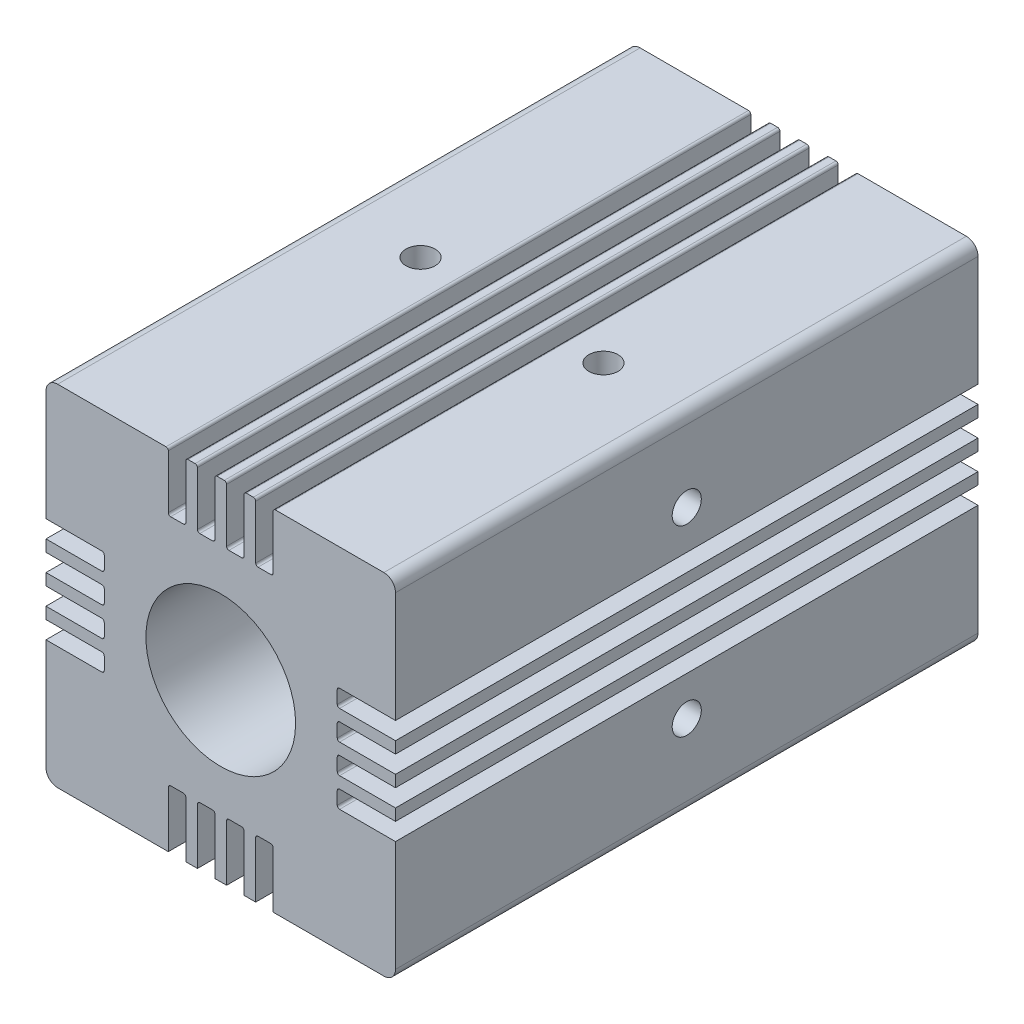
from build123d import *

# Parameters (mm, degrees)
SKETCH1_W                        = 30
SKETCH1_H                        = 30
BOSS_EXTRUDE1_DEPTH              = 50
FILLET1_R                        = 1
CUT_EXTRUDE2_START               = -30
CUT_EXTRUDE2_OUTLINE_R           = 6.425
CUT_EXTRUDE2_DEPTH               = 30
TAP_DRILL_FOR_M3_TAP1_D          = 2.5
TAP_DRILL_FOR_M3_TAP2_AT_2_COUNT = 2
TAP_DRILL_FOR_M3_TAP2_AT_2_PITCH = 15.7
CUT_EXTRUDE5_REACH               = 67.574
SKETCH6_W                        = 1.5
SKETCH6_H                        = 5
FILLET2_R                        = 0.2
CIRPATTERN1_DEPTH                = 50
CIRPATTERN1_2_OUTLINE_R          = 1.25
CIRPATTERN1_2_DEPTH              = 7.1500001
CIRPATTERN1_START                = 22.8499999
CIRPATTERN1_3_OUTLINE_R          = 1.25
CIRPATTERN1_3_DEPTH              = 7.1500001


# Read off the part's stored shape, not the designer's step: Cut-Extrude2, CirPattern1
with BuildPart() as part:
    # Sketch1 → Boss-Extrude1 (new body)
    with BuildSketch(Plane.XY):
        with Locations((15, 15)):
            Rectangle(SKETCH1_W, SKETCH1_H)
    extrude(amount=BOSS_EXTRUDE1_DEPTH)

    # Fillet1
    fillet1_edges = [part.edges().sort_by_distance(p)[0] for p in [
        (0, 30, 25),
        (30, 30, 25),
        (30, 0, 25),
        (0, 0, 25),
    ]]
    fillet(fillet1_edges, radius=FILLET1_R)

    # Cut-Extrude2 outline → Cut-Extrude2 (cut)
    with BuildSketch(Plane.XY.offset(50).offset(CUT_EXTRUDE2_START)):
        with Locations((15, 15)):
            Circle(CUT_EXTRUDE2_OUTLINE_R)
    extrude(amount=CUT_EXTRUDE2_DEPTH, mode=Mode.SUBTRACT)

    # Tap Drill for M3 Tap1 (through all)
    with Locations(Plane(origin=(0, 0, 0), x_dir=(-1, 0, 0), z_dir=(0, -1, 0))):
        with Locations((-7.15, -25), (-22.85, -25)):
            Hole(TAP_DRILL_FOR_M3_TAP1_D / 2)

    # Sketch8 → Tap Drill for M3 Tap2 (revolve, cut)
    with BuildSketch(Plane(origin=(7.15, 0, 25), x_dir=(0, 0, -1), z_dir=(1, 0, 0))):
        Polygon((0, 0), (0, 10.751075774), (1.25, 10), (1.25, 0), align=None)
    tap_drill_for_m3_tap2 = revolve(axis=Axis((7.15, -6.35, 25), (0, 1, 0)), mode=Mode.SUBTRACT)

    # Tap Drill for M3 Tap2 at 2: Tap Drill for M3 Tap2 ×2
    with Locations(*[(i * TAP_DRILL_FOR_M3_TAP2_AT_2_PITCH, 0, 0) for i in range(1, TAP_DRILL_FOR_M3_TAP2_AT_2_COUNT)]):
        add(tap_drill_for_m3_tap2, mode=Mode.SUBTRACT)

    # Sketch6 → Cut-Extrude5 (cut, up to next)
    with BuildSketch(Plane.XY.offset(50), mode=Mode.PRIVATE) as cut_extrude5_sk1:
        with Locations((11.25, 27.5)):
            Rectangle(SKETCH6_W, SKETCH6_H)
    cut_extrude5_tool1 = extrude(cut_extrude5_sk1.sketch, amount=-CUT_EXTRUDE5_REACH, mode=Mode.PRIVATE) & part.part
    # Sketch6 → Cut-Extrude5 (cut, up to next)
    with BuildSketch(Plane.XY.offset(50), mode=Mode.PRIVATE) as cut_extrude5_sk2:
        with Locations((18.75, 27.5)):
            Rectangle(SKETCH6_W, SKETCH6_H)
    cut_extrude5_tool2 = extrude(cut_extrude5_sk2.sketch, amount=-CUT_EXTRUDE5_REACH, mode=Mode.PRIVATE) & part.part
    # Sketch6 → Cut-Extrude5 (cut, up to next)
    with BuildSketch(Plane.XY.offset(50), mode=Mode.PRIVATE) as cut_extrude5_sk3:
        with Locations((13.75, 27.5)):
            Rectangle(SKETCH6_W, SKETCH6_H)
    cut_extrude5_tool3 = extrude(cut_extrude5_sk3.sketch, amount=-CUT_EXTRUDE5_REACH, mode=Mode.PRIVATE) & part.part
    # Sketch6 → Cut-Extrude5 (cut, up to next)
    with BuildSketch(Plane.XY.offset(50), mode=Mode.PRIVATE) as cut_extrude5_sk4:
        with Locations((16.25, 27.5)):
            Rectangle(SKETCH6_W, SKETCH6_H)
    cut_extrude5_tool4 = extrude(cut_extrude5_sk4.sketch, amount=-CUT_EXTRUDE5_REACH, mode=Mode.PRIVATE) & part.part
    add(cut_extrude5_tool1.solids().sort_by_distance((11.25, 27.5, 50))[0], mode=Mode.SUBTRACT)
    add(cut_extrude5_tool2.solids().sort_by_distance((18.75, 27.5, 50))[0], mode=Mode.SUBTRACT)
    add(cut_extrude5_tool3.solids().sort_by_distance((13.75, 27.5, 50))[0], mode=Mode.SUBTRACT)
    add(cut_extrude5_tool4.solids().sort_by_distance((16.25, 27.5, 50))[0], mode=Mode.SUBTRACT)

    # Fillet2
    fillet2_edges = [part.edges().sort_by_distance(p)[0] for p in [
        (18, 25, 25),
        (18, 30, 25),
        (19.5, 30, 25),
        (19.5, 25, 25),
        (10.5, 30, 25),
        (12, 30, 25),
        (12, 25, 25),
        (10.5, 25, 25),
        (13, 30, 25),
        (14.5, 30, 25),
        (14.5, 25, 25),
        (13, 25, 25),
        (15.5, 30, 25),
        (17, 30, 25),
        (17, 25, 25),
        (15.5, 25, 25),
    ]]
    fillet(fillet2_edges, radius=FILLET2_R)

    # CirPattern1 outline → CirPattern1 (cut)
    with BuildSketch(Plane.XY):
        with BuildLine():
            Line((10.5, 0), (12, 0))
            Line((12, 0), (12, 4.8))
            ThreePointArc((12, 4.8), (11.941421356, 4.941421356), (11.8, 5))
            Line((11.8, 5), (10.7, 5))
            ThreePointArc((10.7, 5), (10.558578644, 4.941421356), (10.5, 4.8))
            Line((10.5, 4.8), (10.5, 0))
        make_face()
        with BuildLine():
            Line((18, 4.8), (18, 0))
            Line((18, 0), (19.5, 0))
            Line((19.5, 0), (19.5, 4.8))
            ThreePointArc((19.5, 4.8), (19.441421356, 4.941421356), (19.3, 5))
            Line((19.3, 5), (18.2, 5))
            ThreePointArc((18.2, 5), (18.058578644, 4.941421356), (18, 4.8))
        make_face()
        with BuildLine():
            Line((15.5, 4.8), (15.5, 0))
            Line((15.5, 0), (17, 0))
            Line((17, 0), (17, 4.8))
            ThreePointArc((17, 4.8), (16.941421356, 4.941421356), (16.8, 5))
            Line((16.8, 5), (15.7, 5))
            ThreePointArc((15.7, 5), (15.558578644, 4.941421356), (15.5, 4.8))
        make_face()
        with BuildLine():
            Line((13, 4.8), (13, 0))
            Line((13, 0), (14.5, 0))
            Line((14.5, 0), (14.5, 4.8))
            ThreePointArc((14.5, 4.8), (14.441421356, 4.941421356), (14.3, 5))
            Line((14.3, 5), (13.2, 5))
            ThreePointArc((13.2, 5), (13.058578644, 4.941421356), (13, 4.8))
        make_face()
        with BuildLine():
            ThreePointArc((5, 11.8), (4.941421356, 11.941421356), (4.8, 12))
            Line((4.8, 12), (0, 12))
            Line((0, 12), (0, 10.5))
            Line((0, 10.5), (4.8, 10.5))
            ThreePointArc((4.8, 10.5), (4.941421356, 10.558578644), (5, 10.7))
            Line((5, 10.7), (5, 11.8))
        make_face()
        with BuildLine():
            Line((0, 19.5), (0, 18))
            Line((0, 18), (4.8, 18))
            ThreePointArc((4.8, 18), (4.941421356, 18.058578644), (5, 18.2))
            Line((5, 18.2), (5, 19.3))
            ThreePointArc((5, 19.3), (4.941421356, 19.441421356), (4.8, 19.5))
            Line((4.8, 19.5), (0, 19.5))
        make_face()
        with BuildLine():
            Line((0, 17), (0, 15.5))
            Line((0, 15.5), (4.8, 15.5))
            ThreePointArc((4.8, 15.5), (4.941421356, 15.558578644), (5, 15.7))
            Line((5, 15.7), (5, 16.8))
            ThreePointArc((5, 16.8), (4.941421356, 16.941421356), (4.8, 17))
            Line((4.8, 17), (0, 17))
        make_face()
        with BuildLine():
            Line((0, 14.5), (0, 13))
            Line((0, 13), (4.8, 13))
            ThreePointArc((4.8, 13), (4.941421356, 13.058578644), (5, 13.2))
            Line((5, 13.2), (5, 14.3))
            ThreePointArc((5, 14.3), (4.941421356, 14.441421356), (4.8, 14.5))
            Line((4.8, 14.5), (0, 14.5))
        make_face()
        with BuildLine():
            Line((30, 10.5), (30, 12))
            Line((30, 12), (25.2, 12))
            ThreePointArc((25.2, 12), (25.058578644, 11.941421356), (25, 11.8))
            Line((25, 11.8), (25, 10.7))
            ThreePointArc((25, 10.7), (25.058578644, 10.558578644), (25.2, 10.5))
            Line((25.2, 10.5), (30, 10.5))
        make_face()
        with BuildLine():
            Line((25.2, 18), (30, 18))
            Line((30, 18), (30, 19.5))
            Line((30, 19.5), (25.2, 19.5))
            ThreePointArc((25.2, 19.5), (25.058578644, 19.441421356), (25, 19.3))
            Line((25, 19.3), (25, 18.2))
            ThreePointArc((25, 18.2), (25.058578644, 18.058578644), (25.2, 18))
        make_face()
        with BuildLine():
            Line((25.2, 15.5), (30, 15.5))
            Line((30, 15.5), (30, 17))
            Line((30, 17), (25.2, 17))
            ThreePointArc((25.2, 17), (25.058578644, 16.941421356), (25, 16.8))
            Line((25, 16.8), (25, 15.7))
            ThreePointArc((25, 15.7), (25.058578644, 15.558578644), (25.2, 15.5))
        make_face()
        with BuildLine():
            Line((25.2, 13), (30, 13))
            Line((30, 13), (30, 14.5))
            Line((30, 14.5), (25.2, 14.5))
            ThreePointArc((25.2, 14.5), (25.058578644, 14.441421356), (25, 14.3))
            Line((25, 14.3), (25, 13.2))
            ThreePointArc((25, 13.2), (25.058578644, 13.058578644), (25.2, 13))
        make_face()
    extrude(amount=CIRPATTERN1_DEPTH, mode=Mode.SUBTRACT)

    # CirPattern1 2 outline → CirPattern1 2 (cut)
    with BuildSketch(Plane.YZ):
        with Locations((22.85, 25)):
            Circle(CIRPATTERN1_2_OUTLINE_R)
        with Locations((7.15, 25)):
            Circle(CIRPATTERN1_2_OUTLINE_R)
    extrude(amount=CIRPATTERN1_2_DEPTH, mode=Mode.SUBTRACT)

    # CirPattern1 3 outline → CirPattern1 3 (cut)
    with BuildSketch(Plane.YZ.offset(CIRPATTERN1_START)):
        with Locations((22.85, 25)):
            Circle(CIRPATTERN1_3_OUTLINE_R)
        with Locations((7.15, 25)):
            Circle(CIRPATTERN1_3_OUTLINE_R)
    extrude(amount=CIRPATTERN1_3_DEPTH, mode=Mode.SUBTRACT)

    # CirPattern1 4 outline → CirPattern1 4 (revolve, cut)
    with BuildSketch(Plane(origin=(0, 22.85, 25), x_dir=(0, 1, 0), z_dir=(0, 0, -1))):
        Polygon((0, 19.248924226), (1.25, 20), (1.25, 22.85), (0, 22.85), align=None)
        Polygon((1.25, 10), (0, 10.751075774), (0, 7.15), (1.25, 7.15), align=None)
    revolve(axis=Axis((0, 22.85, 25), (1, 0, 0)), mode=Mode.SUBTRACT)

    # CirPattern1 5 outline → CirPattern1 5 (revolve, cut)
    with BuildSketch(Plane(origin=(0, 7.15, 25), x_dir=(0, 1, 0), z_dir=(0, 0, -1))):
        Polygon((0, 19.248924226), (1.25, 20), (1.25, 22.85), (0, 22.85), align=None)
        Polygon((1.25, 10), (0, 10.751075774), (0, 7.15), (1.25, 7.15), align=None)
    revolve(axis=Axis((0, 7.15, 25), (1, 0, 0)), mode=Mode.SUBTRACT)


solid = part.part
